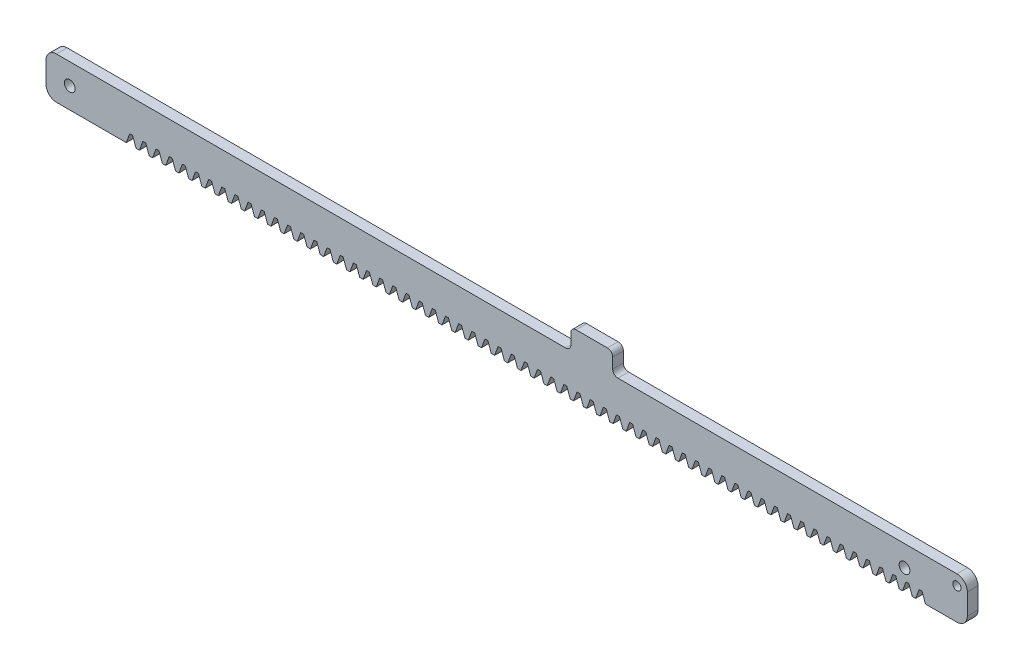
from build123d import *

# Parameters (mm, degrees)
SKETCH1_R           = 2.4892
BOSS_EXTRUDE1_DEPTH = 6.477
FILLET2_R           = 6.35
CUT_EXTRUDE1_DEPTH  = 561.134806568
LPATTERN1_COUNT     = 61
LPATTERN1_PITCH     = 7.979645331
SKETCH3_R           = 3.2639
CUT_EXTRUDE2_DEPTH  = 561.134806568
FILLET3_R           = 3.175


with BuildPart() as part:
    # Sketch1 → Boss-Extrude1 (new body)
    with BuildSketch(Plane.XY):
        Polygon((0, 25.4), (0, 0), (40.530665192, 0), (558.8, 0), (558.8, 25.4), (533.4, 25.4), (447.303292844, 25.4), (343.71026, 25.4), (343.71026, 38.1), (318.31026, 38.1), (318.31026, 25.4), (40.53078, 25.4), align=None)
        with Locations((552.45, 19.05)):
            Circle(SKETCH1_R, mode=Mode.SUBTRACT)
    extrude(amount=BOSS_EXTRUDE1_DEPTH)

    # Fillet2
    fillet2_edges = [part.edges().sort_by_distance(p)[0] for p in [
        (558.8, 0, 3.2385),
        (0, 0, 3.2385),
        (0, 25.4, 3.2385),
        (558.8, 25.4, 3.2385),
    ]]
    fillet(fillet2_edges, radius=FILLET2_R)

    # Sketch2 → Cut-Extrude1 (cut, through all)
    with BuildSketch(Plane.XY.offset(6.477)):
        Polygon((527.46876001, 0), (533.4, 0), (531.319910111, 5.715), (529.548849899, 5.715), align=None)
    cut_extrude1 = extrude(amount=-CUT_EXTRUDE1_DEPTH, mode=Mode.SUBTRACT)

    # LPattern1: Cut-Extrude1 ×61
    with Locations(*[(-i * LPATTERN1_PITCH, 0, 0) for i in range(1, LPATTERN1_COUNT)]):
        add(cut_extrude1, mode=Mode.SUBTRACT)

    # Sketch3 → Cut-Extrude2 (cut, through all)
    with BuildSketch(Plane.XY.offset(6.477)):
        with Locations((520.7, 12.7)):
            Circle(SKETCH3_R)
        with Locations((14.393926, 12.7)):
            Circle(SKETCH3_R)
    extrude(amount=-CUT_EXTRUDE2_DEPTH, mode=Mode.SUBTRACT)

    # Fillet3
    fillet3_edges = [part.edges().sort_by_distance(p)[0] for p in [
        (318.31026, 38.1, 3.2385),
        (318.31026, 25.4, 3.2385),
        (343.71026, 38.1, 3.2385),
        (343.71026, 25.4, 3.2385),
    ]]
    fillet(fillet3_edges, radius=FILLET3_R)


solid = part.part
